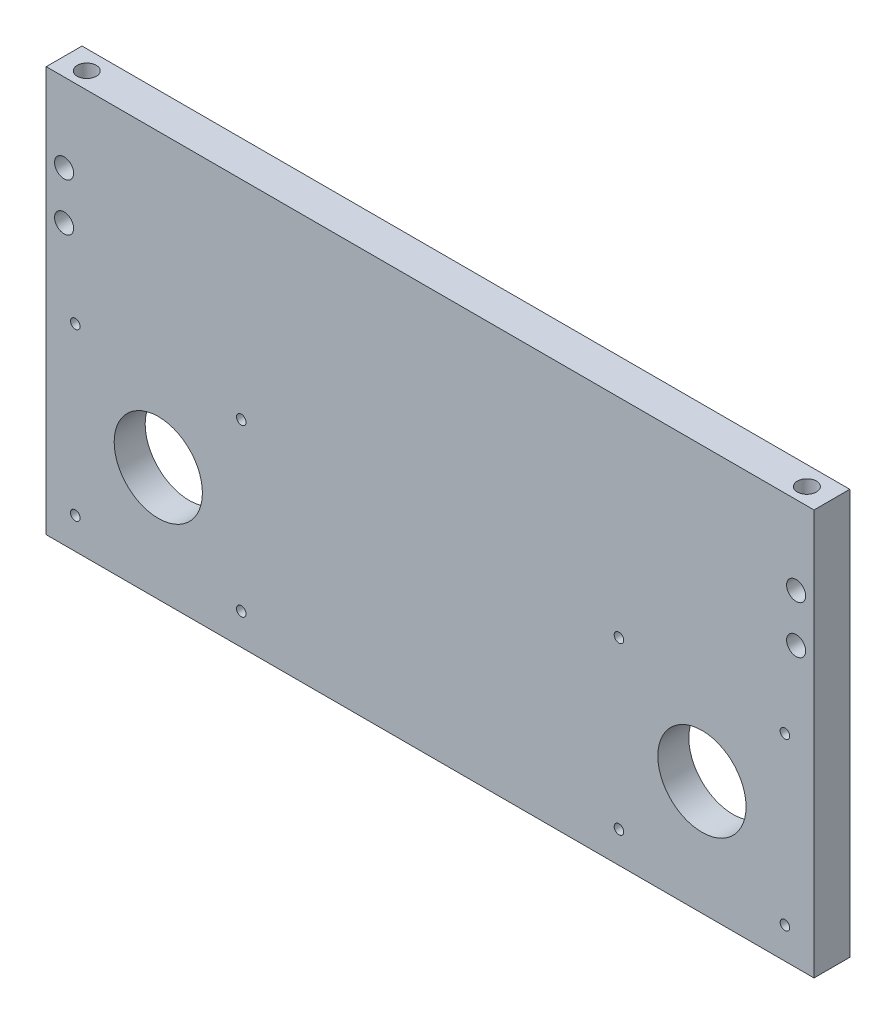
from build123d import *

# Parameters (mm, degrees)
SZKIC1_W                      = 322
SZKIC1_H                      = 170
DODANIE_WYCI_GNI_CIE1_DEPTH   = 15
SZKIC2_R                      = 2
WYTNIJ_WYCI_GNI_CIE2_DEPTH    = 17.75
SZYK_LINIOWY1_COUNT           = 2
SZYK_LINIOWY1_PITCH           = 69.6
SZYK_LINIOWY1_COUNT_DIR2      = 2
SZYK_LINIOWY1_PITCH_DIR2      = 69.6
SZKIC5_R                      = 37.5
WYTNIJ_WYCI_GNI_CIE3_DEPTH    = 2
SZKIC7_R                      = 18.5
WYTNIJ_WYCI_GNI_CIE4_DEPTH    = 17.75
SZYK_LINIOWY2_COUNT           = 2
SZYK_LINIOWY2_PITCH           = 228
SZYK_LINIOWY2_COPY_1_SKETCH_R = 2
SZYK_LINIOWY2_COPY_1_DEPTH    = 17.75
SZYK_LINIOWY2_COPY_2_SKETCH_R = 2
SZYK_LINIOWY2_COPY_2_DEPTH    = 17.75
SZYK_LINIOWY2_COPY_3_SKETCH_R = 2
SZYK_LINIOWY2_COPY_3_DEPTH    = 17.75
SZKIC8_R                      = 4
WYTNIJ_WYCI_GNI_CIE5_DEPTH    = 20
SZKIC10_R                     = 4
WYTNIJ_WYCI_GNI_CIE7_DEPTH    = 183.677311125
SZKIC11_R                     = 4
WYTNIJ_WYCI_GNI_CIE8_DEPTH    = 183.677311125


with BuildPart() as part:
    # Szkic1 → Dodanie-wyciągnięcie1 (new body)
    with BuildSketch(Plane.XY):
        Rectangle(SZKIC1_W, SZKIC1_H)
    extrude(amount=DODANIE_WYCI_GNI_CIE1_DEPTH)

    # Szkic2 → Wytnij-wyciągnięcie2 (cut)
    with BuildSketch(Plane.XY.offset(15)):
        with Locations((-148.8, -71.87)):
            Circle(SZKIC2_R)
    wytnij_wyci_gni_cie2 = extrude(amount=-WYTNIJ_WYCI_GNI_CIE2_DEPTH, mode=Mode.SUBTRACT)

    # Szyk liniowy1: Wytnij-wyci_gni_cie2 2 × 2
    with Locations(*[(i * SZYK_LINIOWY1_PITCH, j * SZYK_LINIOWY1_PITCH_DIR2, 0) for i in range(SZYK_LINIOWY1_COUNT) for j in range(SZYK_LINIOWY1_COUNT_DIR2) if (i, j) != (0, 0)]):
        add(wytnij_wyci_gni_cie2, mode=Mode.SUBTRACT)

    # Szkic5 → Wytnij-wyciągnięcie3 (cut)
    with BuildSketch(Plane(origin=(0, 0, 0), x_dir=(-1, 0, 0), z_dir=(0, 0, -1))):
        with Locations((114, -37.07)):
            Circle(SZKIC5_R)
    wytnij_wyci_gni_cie3 = extrude(amount=-WYTNIJ_WYCI_GNI_CIE3_DEPTH, mode=Mode.SUBTRACT)

    # Szkic7 → Wytnij-wyciągnięcie4 (cut)
    with BuildSketch(Plane(origin=(0, 0, 2), x_dir=(-1, 0, 0), z_dir=(0, 0, -1))):
        with Locations((114, -37.07)):
            Circle(SZKIC7_R)
    wytnij_wyci_gni_cie4 = extrude(amount=-WYTNIJ_WYCI_GNI_CIE4_DEPTH, mode=Mode.SUBTRACT)

    # Szyk liniowy2: Wytnij-wyciągnięcie2, Wytnij-wyciągnięcie3, Wytnij-wyciągnięcie4 ×2
    with Locations(*[(i * SZYK_LINIOWY2_PITCH, 0, 0) for i in range(1, SZYK_LINIOWY2_COUNT)]):
        add(wytnij_wyci_gni_cie2, mode=Mode.SUBTRACT)
        add(wytnij_wyci_gni_cie3, mode=Mode.SUBTRACT)
        add(wytnij_wyci_gni_cie4, mode=Mode.SUBTRACT)

    # Szyk liniowy2 copy 1 sketch → Szyk liniowy2 copy 1 (cut)
    with BuildSketch(Plane(origin=(228, 69.6, 15), x_dir=(1, 0, 0), z_dir=(0, 0, 1))):
        with Locations((-148.8, -71.87)):
            Circle(SZYK_LINIOWY2_COPY_1_SKETCH_R)
    extrude(amount=-SZYK_LINIOWY2_COPY_1_DEPTH, mode=Mode.SUBTRACT)

    # Szyk liniowy2 copy 2 sketch → Szyk liniowy2 copy 2 (cut)
    with BuildSketch(Plane(origin=(297.6, 0, 15), x_dir=(1, 0, 0), z_dir=(0, 0, 1))):
        with Locations((-148.8, -71.87)):
            Circle(SZYK_LINIOWY2_COPY_2_SKETCH_R)
    extrude(amount=-SZYK_LINIOWY2_COPY_2_DEPTH, mode=Mode.SUBTRACT)

    # Szyk liniowy2 copy 3 sketch → Szyk liniowy2 copy 3 (cut)
    with BuildSketch(Plane(origin=(297.6, 69.6, 15), x_dir=(1, 0, 0), z_dir=(0, 0, 1))):
        with Locations((-148.8, -71.87)):
            Circle(SZYK_LINIOWY2_COPY_3_SKETCH_R)
    extrude(amount=-SZYK_LINIOWY2_COPY_3_DEPTH, mode=Mode.SUBTRACT)

    # Szkic8 → Wytnij-wyciągnięcie5 (cut)
    with BuildSketch(Plane(origin=(0, 85, 0), x_dir=(1, 0, 0), z_dir=(0, 1, 0))):
        with Locations((-151, -8)):
            Circle(SZKIC8_R)
        with Locations((151, -8)):
            Circle(SZKIC8_R)
    extrude(amount=-WYTNIJ_WYCI_GNI_CIE5_DEPTH, mode=Mode.SUBTRACT)

    # Szkic10 → Wytnij-wyciągnięcie7 (cut, through all)
    with BuildSketch(Plane.XY.offset(15)):
        with Locations((-153.5, 52)):
            Circle(SZKIC10_R)
        with Locations((-153.5, 32)):
            Circle(SZKIC10_R)
    extrude(amount=-WYTNIJ_WYCI_GNI_CIE7_DEPTH, mode=Mode.SUBTRACT)

    # Szkic11 → Wytnij-wyciągnięcie8 (cut, through all)
    with BuildSketch(Plane.XY.offset(15)):
        with Locations((153.5, 32)):
            Circle(SZKIC11_R)
        with Locations((153.5, 52)):
            Circle(SZKIC11_R)
    extrude(amount=-WYTNIJ_WYCI_GNI_CIE8_DEPTH, mode=Mode.SUBTRACT)


solid = part.part
